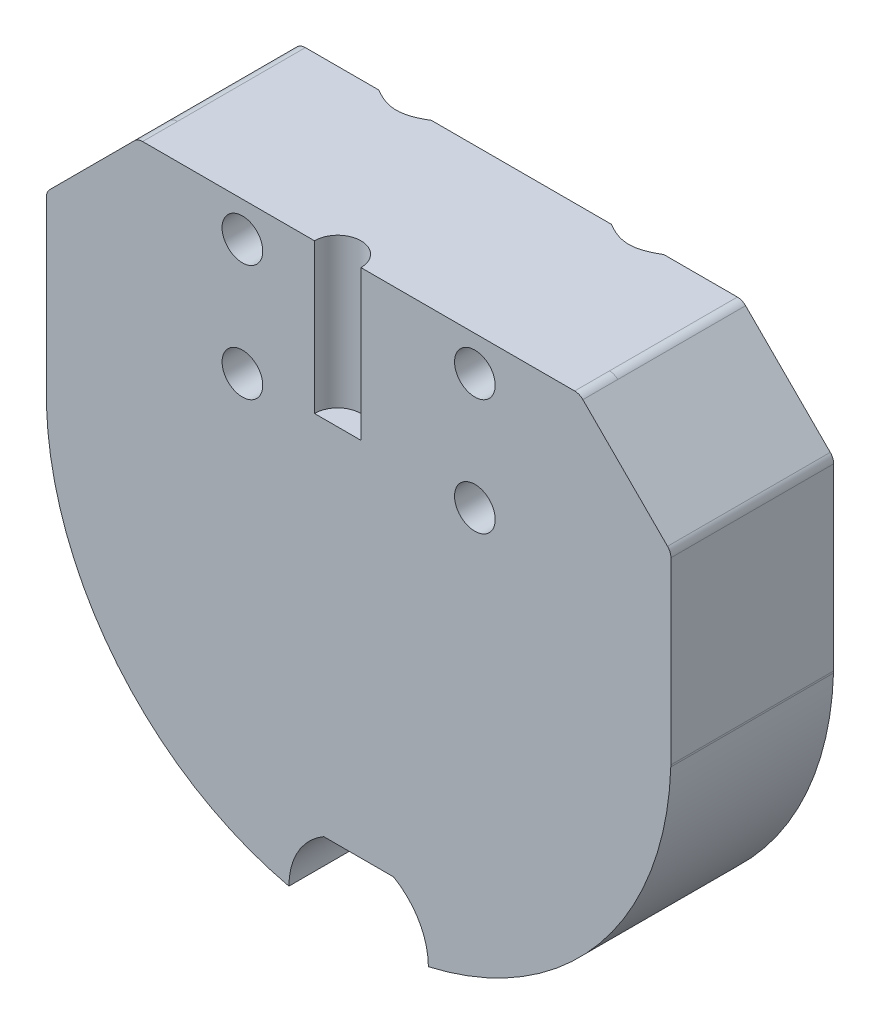
from build123d import *
from build123d.topology import SkipClean

# Parameters (mm, degrees)
CROQUIS3_W                   = 38
CROQUIS3_H                   = 38
SALIENTE_EXTRUIR9_DEPTH      = 1
SALIENTE_EXTRUIR10_START     = -11
SALIENTE_EXTRUIR10_OUTLINE_W = 38
SALIENTE_EXTRUIR10_OUTLINE_H = 38
SALIENTE_EXTRUIR10_DEPTH     = 10
CROQUIS13_W                  = 38
CROQUIS13_H                  = 38
SALIENTE_EXTRUIR15_DEPTH     = 3
CROQUIS14_R                  = 1.75
CORTAR_EXTRUIR1_DEPTH        = 14
CROQUIS15_W                  = 38
CROQUIS15_H                  = 24.129942315
CROQUIS15_R                  = 3.5
SALIENTE_EXTRUIR16_DEPTH     = 1
CORTAR_EXTRUIR2_DEPTH        = 14
SALIENTE_EXTRUIR17_DEPTH     = 5
SALIENTE_EXTRUIR18_DEPTH     = 5
CORTAR_EXTRUIR3_DEPTH        = 3
REDONDEO11_R                 = 1
CROQUIS21_R                  = 1.75
CORTAR_EXTRUIR4_DEPTH        = 11
SALIENTE_EXTRUIR20_START     = 3
CROQUIS22_R                  = 3
CROQUIS22_R_2                = 1.75
SALIENTE_EXTRUIR20_DEPTH     = 3
CHAFL_N1_SIZE                = 2
REDONDEO13_R                 = 1
SALIENTE_EXTRUIR22_DEPTH     = 3
REDONDEO14_R                 = 5
SALIENTE_EXTRUIR25_DEPTH     = 1
SALIENTE_EXTRUIR26_DEPTH     = 13
CROQUIS30_W                  = 12
CROQUIS30_H                  = 8
SALIENTE_EXTRUIR27_DEPTH     = 15
SALIENTE_EXTRUIR28_DEPTH     = 8
CORTAR_EXTRUIR5_DEPTH        = 30
CROQUIS35_R                  = 3
SALIENTE_EXTRUIR29_DEPTH     = 3
CORTAR_EXTRUIR6_DEPTH        = 5


# Read off the part's stored shape, not the designer's step: Saliente-Extruir10
with BuildPart() as part:
    # Croquis3 → Saliente-Extruir9 (new body)
    with BuildSketch(Plane.XY.offset(5)):
        Polygon((19, -5.370057685), (26.870057685, 2.5), (26.870057685, 40.5), (19, 48.370057685), (-19, 48.370057685), (-26.870057685, 40.5), (-26.870057685, 2.5), (-19, -5.370057685), align=None)
        with Locations((0, 21.5)):
            Rectangle(CROQUIS3_W, CROQUIS3_H, mode=Mode.SUBTRACT)
    extrude(amount=-SALIENTE_EXTRUIR9_DEPTH)

    # Saliente-Extruir10 outline → Saliente-Extruir10 (add)
    with BuildSketch(Plane(origin=(0, 0, 4), x_dir=(-1, 0, 0), z_dir=(0, 0, -1)).offset(SALIENTE_EXTRUIR10_START)):
        Polygon((-26.870057685, 2.5), (-19, -5.370057685), (19, -5.370057685), (26.870057685, 2.5), (26.870057685, 40.5), (19, 48.370057685), (-19, 48.370057685), (-26.870057685, 40.5), align=None)
        with Locations((0, 21.5)):
            Rectangle(SALIENTE_EXTRUIR10_OUTLINE_W, SALIENTE_EXTRUIR10_OUTLINE_H, mode=Mode.SUBTRACT)
    extrude(amount=SALIENTE_EXTRUIR10_DEPTH)

    # Croquis13 → Saliente-Extruir15 (add)
    with BuildSketch(Plane.XY.offset(15)):
        with BuildLine():
            Line((-22.5, 44.870057685), (-22.5, -1))
            Line((-22.5, -1), (22.5, -1))
            Line((22.5, -1), (22.5, 44.870057685))
            Line((22.5, 44.870057685), (19.292893219, 48.077164466))
            ThreePointArc((19.292893219, 48.077164466), (18.96846987, 48.293937218), (18.585786438, 48.370057685))
            Line((18.585786438, 48.370057685), (-18.585786438, 48.370057685))
            ThreePointArc((-18.585786438, 48.370057685), (-18.96846987, 48.293937218), (-19.292893219, 48.077164466))
            Line((-19.292893219, 48.077164466), (-22.5, 44.870057685))
        make_face()
        with Locations((0, 21.5)):
            Rectangle(CROQUIS13_W, CROQUIS13_H, mode=Mode.SUBTRACT)
    extrude(amount=SALIENTE_EXTRUIR15_DEPTH)

    # Croquis14 → Cortar-Extruir1 (cut)
    with BuildSketch(Plane(origin=(0, 0, 4), x_dir=(-1, 0, 0), z_dir=(0, 0, -1))):
        with Locations((10, 45.37415474)):
            Circle(CROQUIS14_R)
        with Locations(Location((-10, 45.37415474, 0), (0, 0, 180))):
            Circle(CROQUIS14_R)
    extrude(amount=-CORTAR_EXTRUIR1_DEPTH, mode=Mode.SUBTRACT)

    # Croquis15 → Saliente-Extruir16 (add)
    with BuildSketch(Plane(origin=(0, 0, 4), x_dir=(-1, 0, 0), z_dir=(0, 0, -1))):
        with Locations((0, 28.435028843)):
            Rectangle(CROQUIS15_W, CROQUIS15_H)
        with Locations((0, 25.370057685)):
            Circle(CROQUIS15_R, mode=Mode.SUBTRACT)
    extrude(amount=-SALIENTE_EXTRUIR16_DEPTH)

    # Croquis16 → Cortar-Extruir2 (cut)
    with BuildSketch(Plane(origin=(0, 0, 4), x_dir=(-1, 0, 0), z_dir=(0, 0, -1))):
        Polygon((-19, 2.5), (-19, 16.370057685), (-26.870057685, 24.24011537), (-26.870057685, 2.5), (-19, -5.370057685), (19, -5.370057685), (26.870057685, 2.5), (26.870057685, 24.24011537), (19, 16.370057685), (19, 2.5), align=None)
    extrude(amount=-CORTAR_EXTRUIR2_DEPTH, mode=Mode.SUBTRACT)

    # Croquis17 → Saliente-Extruir17 (add)
    with BuildSketch(Plane.XY.offset(5)):
        Polygon((6, 31.370057685), (6, 25.370057685), (6, 19.370057685), (6, 16.370057685), (19, 16.370057685), (19, 40.5), (-19, 40.5), (-19, 16.370057685), (-6, 16.370057685), (-6, 19.370057685), (-6, 31.370057685), align=None)
    extrude(amount=SALIENTE_EXTRUIR17_DEPTH)

    # Croquis18 → Saliente-Extruir18 (add)
    with BuildSketch(Plane.XY.offset(10)):
        Polygon((-19, 40.5), (-19, 16.370057685), (-6, 16.370057685), (-6, 19.370057685), (6, 19.370057685), (6, 16.370057685), (19, 16.370057685), (19, 40.5), align=None)
    extrude(amount=SALIENTE_EXTRUIR18_DEPTH)

    # Croquis19 → Cortar-Extruir3 (cut)
    with BuildSketch(Plane.XY.offset(18)):
        Polygon((-22.5, 19.870057685), (-19, 16.370057685), (-19, 21.370057685), (-22.5, 21.370057685), align=None)
        Polygon((19, 16.370057685), (22.5, 19.870057685), (22.5, 21.370057685), (19, 21.370057685), align=None)
    extrude(amount=-CORTAR_EXTRUIR3_DEPTH, mode=Mode.SUBTRACT)

    # Redondeo11
    redondeo11_edges = [part.edges().sort_by_distance(p)[0] for p in [
        (26.870057685, 40.5, 10),
        (19, 48.370057685, 10),
        (-19, 48.370057685, 10),
        (-26.870057685, 40.5, 10),
        (26.870057685, 24.24011537, 9.5),
        (19, 16.370057685, 9.5),
        (-26.870057685, 24.24011537, 9.5),
        (-19, 16.370057685, 9.5),
    ]]
    fillet(redondeo11_edges, radius=REDONDEO11_R)

    # Croquis21 → Cortar-Extruir4 (cut)
    with BuildSketch(Plane.XY.offset(15)):
        with Locations((-10, 35.37415474)):
            Circle(CROQUIS21_R)
        with Locations((10, 35.37415474)):
            Circle(CROQUIS21_R)
    extrude(amount=-CORTAR_EXTRUIR4_DEPTH, mode=Mode.SUBTRACT)

    # Croquis22 → Saliente-Extruir20 (add)
    # profile 1 of 2: a face of its own
    with BuildSketch(Plane.XY.offset(15).offset(SALIENTE_EXTRUIR20_START)):
        with Locations(Location((-10, 35.37415474, 0), (0, 0, 180))):
            Circle(CROQUIS22_R)
        with Locations((-10, 35.37415474)):
            Circle(CROQUIS22_R_2, mode=Mode.SUBTRACT)
    # profile 2 of 2: a face of its own
    with BuildSketch(Plane.XY.offset(15).offset(SALIENTE_EXTRUIR20_START)):
        with Locations(Location((10, 35.37415474, 0), (0, 0, 180))):
            Circle(CROQUIS22_R)
        with Locations((10, 35.37415474)):
            Circle(CROQUIS22_R_2, mode=Mode.SUBTRACT)
    extrude(amount=-SALIENTE_EXTRUIR20_DEPTH)

    # Croquis23 → Cortar-Revolución1 (revolve, cut)
    with BuildSketch(Plane.XY.offset(18)):
        Polygon((-1.8, 48.370057685), (-1.8, 44.97415474), (-1.8, 40.5), (0.2, 40.5), (0.2, 48.370057685), align=None)
    revolve(axis=Axis((-1.8, 44.97415474, 18), (0, 1, 0)), mode=Mode.SUBTRACT)

    # Chaflán1
    # the kernel refuses this chamfer: 2 mm, written as the material it takes off along each edge
    with BuildSketch(Plane(origin=(-10, 45.37415474, 4), x_dir=(-1, 0, 0), z_dir=(0, -1, 0))) as chafl_n1_piece_1:
        Polygon((1.75 + CHAFL_N1_SIZE, 0), (1.75, -CHAFL_N1_SIZE), (1.75, 0), align=None)
    revolve(axis=Axis((-10, 45.37415474, 4), (0, 0, -1)), mode=Mode.SUBTRACT)
    with BuildSketch(Plane(origin=(10, 45.37415474, 4), x_dir=(1, 0, 0), z_dir=(0, 1, 0))) as chafl_n1_piece_2:
        Polygon((1.75 + CHAFL_N1_SIZE, 0), (1.75, -CHAFL_N1_SIZE), (1.75, 0), align=None)
    revolve(axis=Axis((10, 45.37415474, 4), (0, 0, -1)), mode=Mode.SUBTRACT)
    with BuildSketch(Plane(origin=(-10, 35.37415474, 4), x_dir=(1, 0, 0), z_dir=(0, -1, 0))) as chafl_n1_piece_3:
        Polygon((1.75 + CHAFL_N1_SIZE, 0), (1.75, CHAFL_N1_SIZE), (1.75, 0), align=None)
    revolve(axis=Axis((-10, 35.37415474, 4), (0, 0, 1)), mode=Mode.SUBTRACT)
    with BuildSketch(Plane(origin=(10, 35.37415474, 4), x_dir=(1, 0, 0), z_dir=(0, -1, 0))) as chafl_n1_piece_4:
        Polygon((1.75 + CHAFL_N1_SIZE, 0), (1.75, CHAFL_N1_SIZE), (1.75, 0), align=None)
    revolve(axis=Axis((10, 35.37415474, 4), (0, 0, 1)), mode=Mode.SUBTRACT)

    # Redondeo13
    redondeo13_edges = [part.edges().sort_by_distance(p)[0] for p in [
        (22.5, 21.370057685, 16.5),
        (19, 21.370057685, 16.5),
        (-19, 21.370057685, 16.5),
        (-22.5, 21.370057685, 16.5),
    ]]
    fillet(redondeo13_edges, radius=REDONDEO13_R)

    # Croquis26 → Saliente-Extruir22 (add)
    with BuildSketch(Plane.XY.offset(15)):
        with BuildLine():
            Line((19, 22.370057685), (-19, 22.370057685))
            ThreePointArc((-19, 22.370057685), (-19.292893219, 21.662950904), (-20, 21.370057685))
            Line((-20, 21.370057685), (-21.5, 21.370057685))
            ThreePointArc((-21.5, 21.370057685), (-22.207106781, 21.662950904), (-22.5, 22.370057685))
            Line((-22.5, 22.370057685), (-22.5, 44.870057685))
            Line((-22.5, 44.870057685), (-26.577164466, 40.792893219))
            ThreePointArc((-26.577164466, 40.792893219), (-26.793937218, 40.46846987), (-26.870057685, 40.085786438))
            Line((-26.870057685, 40.085786438), (-26.870057685, 24.654328933))
            ThreePointArc((-26.870057685, 24.654328933), (-26.793937218, 24.2716455), (-26.577164466, 23.947222151))
            Line((-26.577164466, 23.947222151), (-19.292893219, 16.662950904))
            ThreePointArc((-19.292893219, 16.662950904), (-18.96846987, 16.446178153), (-18.585786438, 16.370057685))
            Line((-18.585786438, 16.370057685), (-6, 16.370057685))
            Line((-6, 16.370057685), (-6, 19.370057685))
            Line((-6, 19.370057685), (6, 19.370057685))
            Line((6, 19.370057685), (6, 16.370057685))
            Line((6, 16.370057685), (18.585786438, 16.370057685))
            ThreePointArc((18.585786438, 16.370057685), (18.96846987, 16.446178153), (19.292893219, 16.662950904))
            Line((19.292893219, 16.662950904), (26.577164466, 23.947222151))
            ThreePointArc((26.577164466, 23.947222151), (26.793937218, 24.2716455), (26.870057685, 24.654328933))
            Line((26.870057685, 24.654328933), (26.870057685, 40.085786438))
            ThreePointArc((26.870057685, 40.085786438), (26.793937218, 40.46846987), (26.577164466, 40.792893219))
            Line((26.577164466, 40.792893219), (22.5, 44.870057685))
            Line((22.5, 44.870057685), (22.5, 22.370057685))
            ThreePointArc((22.5, 22.370057685), (22.207106781, 21.662950904), (21.5, 21.370057685))
            Line((21.5, 21.370057685), (20, 21.370057685))
            ThreePointArc((20, 21.370057685), (19.292893219, 21.662950904), (19, 22.370057685))
        make_face()
    extrude(amount=SALIENTE_EXTRUIR22_DEPTH)

    # Redondeo14
    redondeo14_edges = [part.edges().sort_by_distance(p)[0] for p in [
        (-19, 40.5, 16.5),
        (19, 40.5, 16.5),
        (19, 22.370057685, 16.5),
        (-19, 22.370057685, 16.5),
    ]]
    fillet(redondeo14_edges, radius=REDONDEO14_R)

    # Croquis28 → Saliente-Extruir25 (add)
    with BuildSketch(Plane(origin=(0, 0, 4), x_dir=(-1, 0, 0), z_dir=(0, 0, -1))):
        with BuildLine():
            ThreePointArc((-26.855444452, 24.483997139), (0, -1.5), (26.855444452, 24.483997139))
            ThreePointArc((26.855444452, 24.483997139), (26.757844512, 24.194074057), (26.577164466, 23.947222151))
            Line((26.577164466, 23.947222151), (19.292893219, 16.662950904))
            ThreePointArc((19.292893219, 16.662950904), (18.96846987, 16.446178153), (18.585786438, 16.370057685))
            Line((18.585786438, 16.370057685), (-18.585786438, 16.370057685))
            ThreePointArc((-18.585786438, 16.370057685), (-18.96846987, 16.446178153), (-19.292893219, 16.662950904))
            Line((-19.292893219, 16.662950904), (-26.577164466, 23.947222151))
            ThreePointArc((-26.577164466, 23.947222151), (-26.757844512, 24.194074057), (-26.855444452, 24.483997139))
        make_face()
    extrude(amount=-SALIENTE_EXTRUIR25_DEPTH)

    # Croquis29 → Saliente-Extruir26 (add)
    with BuildSketch(Plane.XY.offset(5)):
        with BuildLine():
            Line((-6, 16.370057685), (-6, -0.821544022))
            ThreePointArc((-6, -0.821544022), (-20.735541008, 8.280957677), (-26.855444452, 24.483997139))
            Line((-26.855444452, 24.483997139), (-6, 16.370057685))
        make_face()
        with BuildLine():
            Line((6, 16.370057685), (6, -0.821544022))
            ThreePointArc((6, -0.821544022), (20.735541008, 8.280957677), (26.855444452, 24.483997139))
            Line((26.855444452, 24.483997139), (6, 16.370057685))
        make_face()
    extrude(amount=SALIENTE_EXTRUIR26_DEPTH)

    # Croquis30 → Saliente-Extruir27 (add)
    with BuildSketch(Plane.XZ.offset(-19.370057685)):
        with Locations((0, 14)):
            Rectangle(CROQUIS30_W, CROQUIS30_H)
    extrude(amount=SALIENTE_EXTRUIR27_DEPTH)

    # Croquis31 → Saliente-Extruir28 (add)
    with BuildSketch(Plane.XY.offset(18)):
        with BuildLine():
            ThreePointArc((-6, -0.821544022), (-4.242640687, 3.421096665), (0, 5.178455978))
            Line((0, 5.178455978), (-6, 5.178455978))
            Line((-6, 5.178455978), (-6, -0.821544022))
        make_face()
        with BuildLine():
            Line((6, 5.178455978), (0, 5.178455978))
            ThreePointArc((0, 5.178455978), (4.242640687, 3.421096665), (6, -0.821544022))
            Line((6, -0.821544022), (6, 5.178455978))
        make_face()
    extrude(amount=-SALIENTE_EXTRUIR28_DEPTH)

    # Croquis34 → Cortar-Extruir5 (cut)
    with BuildSketch(Plane(origin=(0, -1.5, 0), x_dir=(-1, 0, 0), z_dir=(0, -1, 0))):
        Polygon((9.602722226, -7.5), (10.877722226, -4), (15.977722226, -4), (17.252722226, -7.5), align=None)
        Polygon((-9.602722226, -7.5), (-17.252722226, -7.5), (-15.977722226, -4), (-10.877722226, -4), align=None)
    extrude(amount=-CORTAR_EXTRUIR5_DEPTH, mode=Mode.SUBTRACT)

    # Croquis35 → Saliente-Extruir29 (add)
    with BuildSketch(Plane.XY.offset(15)):
        with BuildLine():
            Line((-14, 40.5), (14, 40.5))
            ThreePointArc((14, 40.5), (17.535533906, 39.035533906), (19, 35.5))
            Line((19, 35.5), (19, 27.370057685))
            ThreePointArc((19, 27.370057685), (17.535533906, 23.834523779), (14, 22.370057685))
            Line((14, 22.370057685), (-14, 22.370057685))
            ThreePointArc((-14, 22.370057685), (-17.535533906, 23.834523779), (-19, 27.370057685))
            Line((-19, 27.370057685), (-19, 35.5))
            ThreePointArc((-19, 35.5), (-17.535533906, 39.035533906), (-14, 40.5))
        make_face()
        with Locations((-10, 35.37415474)):
            Circle(CROQUIS35_R, mode=Mode.SUBTRACT)
        with Locations((10, 35.37415474)):
            Circle(CROQUIS35_R, mode=Mode.SUBTRACT)
    extrude(amount=SALIENTE_EXTRUIR29_DEPTH)

    # Croquis36 → Cortar-Extruir6 (cut)
    with SkipClean():  # the faces are left unmerged after this step: merging them gives an invalid solid
        with BuildSketch(Plane(origin=(0, 40.5, 0), x_dir=(1, 0, 0), z_dir=(0, 1, 0))):
            with BuildLine():
                Line((0.2, -18), (-3.8, -18))
                ThreePointArc((-3.8, -18), (-1.8, -16), (0.2, -18))
            make_face()
        extrude(amount=-CORTAR_EXTRUIR6_DEPTH, mode=Mode.SUBTRACT)
    add(part.part.scale(1), mode=Mode.REPLACE)  # the faces are merged on a copy


solid = part.part
